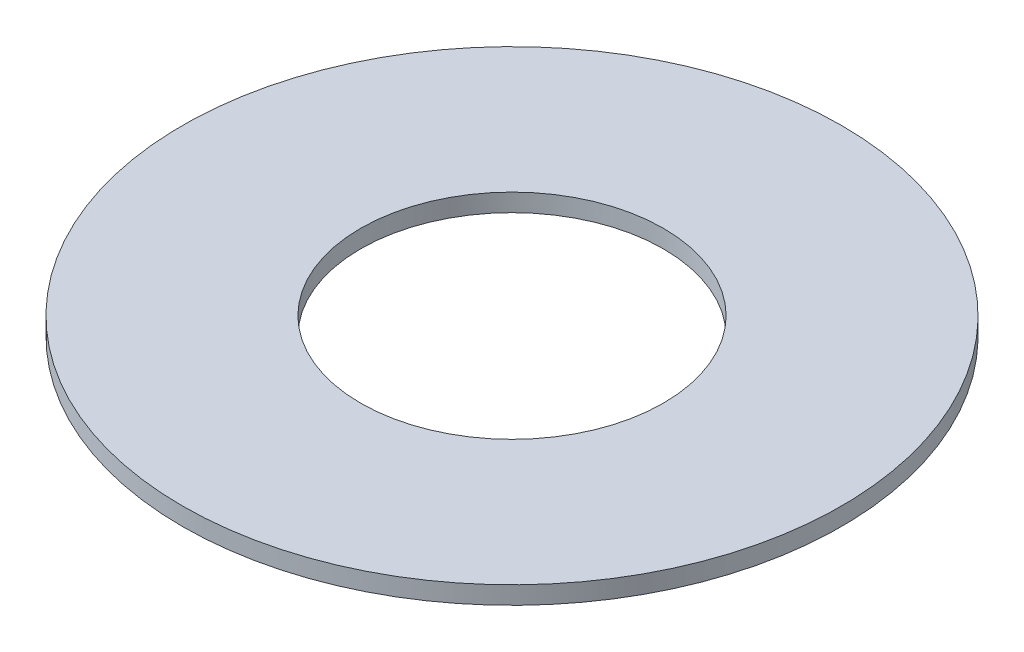
from build123d import *

# Parameters (mm, degrees)
SKETCH1_R           = 92.5
BOSS_EXTRUDE1_DEPTH = 5
SKETCH2_R           = 42.5
CUT_EXTRUDE1_DEPTH  = 131.910274616


with BuildPart() as part:
    # Sketch1 → Boss-Extrude1 (new body)
    with BuildSketch(Plane(origin=(0, 0, 0), x_dir=(1, 0, 0), z_dir=(0, 1, 0))):
        Circle(SKETCH1_R)
    extrude(amount=BOSS_EXTRUDE1_DEPTH)

    # Sketch2 → Cut-Extrude1 (cut, through all)
    with BuildSketch(Plane(origin=(0, 0, 0), x_dir=(1, 0, 0), z_dir=(0, 1, 0))):
        Circle(SKETCH2_R)
    extrude(amount=CUT_EXTRUDE1_DEPTH, mode=Mode.SUBTRACT)


solid = part.part
